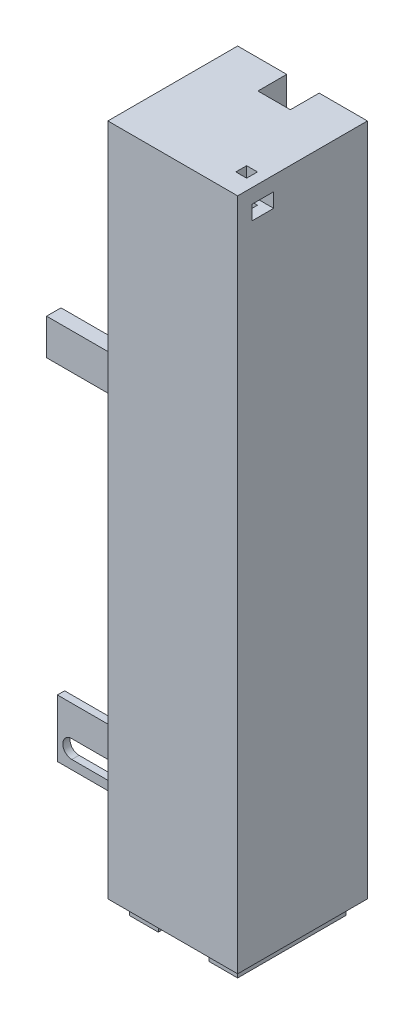
from build123d import *

# Parameters (mm, degrees)
SKETCH1_W           = 36
SKETCH1_H           = 36
BOSS_EXTRUDE1_DEPTH = 186.9
BOSS_EXTRUDE2_DEPTH = 4
SKETCH3_R           = 2
CUT_EXTRUDE1_DEPTH  = 5
SKETCH4_W           = 9
SKETCH4_H           = 186.9
CUT_EXTRUDE2_DEPTH  = 8
SKETCH5_W           = 6
SKETCH5_H           = 4
CUT_EXTRUDE3_DEPTH  = 9
SKETCH6_W           = 3
SKETCH6_H           = 3
CUT_EXTRUDE4_DEPTH  = 10
SKETCH7_W           = 2
SKETCH7_H           = 16
BOSS_EXTRUDE3_DEPTH = 40
CUT_EXTRUDE5_REACH  = 194.893
SKETCH9_W           = 4
SKETCH9_H           = 10
BOSS_EXTRUDE4_DEPTH = 45
CHAMFER1_SIZE       = 20
CUT_EXTRUDE6_DEPTH  = 27


with BuildPart() as part:
    # Sketch1 → Boss-Extrude1 (new body)
    with BuildSketch(Plane(origin=(0, 0, 0), x_dir=(1, 0, 0), z_dir=(0, 1, 0))):
        with Locations((18, 18)):
            Rectangle(SKETCH1_W, SKETCH1_H)
    extrude(amount=BOSS_EXTRUDE1_DEPTH)

    # Sketch2 → Boss-Extrude2 (add)
    with BuildSketch(Plane.XZ):
        Polygon((3, -3), (7, -3), (11, -3), (11, -11), (7, -11), (7, -25), (11, -25), (11, -33), (7, -33), (3, -33), align=None)
        Polygon((29, -3), (33, -3), (33, -33), (29, -33), (25, -33), (25, -25), (29, -25), (29, -11), (25, -11), (25, -3), align=None)
    extrude(amount=BOSS_EXTRUDE2_DEPTH)

    # Sketch3 → Cut-Extrude1 (cut)
    with BuildSketch(Plane.XZ):
        with Locations((18, -18)):
            Circle(SKETCH3_R)
    extrude(amount=-CUT_EXTRUDE1_DEPTH, mode=Mode.SUBTRACT)

    # Sketch4 → Cut-Extrude2 (cut)
    with BuildSketch(Plane.XY.offset(-36)):
        with Locations((18.12, 93.45)):
            Rectangle(SKETCH4_W, SKETCH4_H)
    extrude(amount=CUT_EXTRUDE2_DEPTH, mode=Mode.SUBTRACT)

    # Sketch5 → Cut-Extrude3 (cut)
    with BuildSketch(Plane(origin=(36, 0, 0), x_dir=(0, 0, -1), z_dir=(1, 0, 0))):
        with Locations((7, 180.9)):
            Rectangle(SKETCH5_W, SKETCH5_H)
    extrude(amount=-CUT_EXTRUDE3_DEPTH, mode=Mode.SUBTRACT)

    # Sketch6 → Cut-Extrude4 (cut)
    with BuildSketch(Plane(origin=(0, 186.9, 0), x_dir=(1, 0, 0), z_dir=(0, 1, 0))):
        with Locations((31.5, 7)):
            Rectangle(SKETCH6_W, SKETCH6_H)
    extrude(amount=-CUT_EXTRUDE4_DEPTH, mode=Mode.SUBTRACT)

    # Sketch7 → Boss-Extrude3 (add)
    with BuildSketch(Plane.ZY):
        with Locations((-27, 8)):
            Rectangle(SKETCH7_W, SKETCH7_H)
    extrude(amount=BOSS_EXTRUDE3_DEPTH)

    # Sketch8 → Cut-Extrude5 (cut, up to next)
    with BuildSketch(Plane.XY.offset(-26), mode=Mode.PRIVATE) as cut_extrude5_sk1:
        with BuildLine():
            Line((-36, 7.5), (-12, 7.5))
            ThreePointArc((-12, 7.5), (-9.5, 5), (-12, 2.5))
            Line((-12, 2.5), (-36, 2.5))
            ThreePointArc((-36, 2.5), (-38.5, 5), (-36, 7.5))
        make_face()
    cut_extrude5_tool1 = extrude(cut_extrude5_sk1.sketch, amount=-CUT_EXTRUDE5_REACH, mode=Mode.PRIVATE) & part.part
    add(cut_extrude5_tool1.solids().sort_by_distance((-24, 5, -26))[0], mode=Mode.SUBTRACT)

    # Sketch9 → Boss-Extrude4 (add)
    with BuildSketch(Plane.ZY):
        with Locations((-30, 98.5)):
            Rectangle(SKETCH9_W, SKETCH9_H)
    extrude(amount=BOSS_EXTRUDE4_DEPTH)

    # Chamfer1
    chamfer1_edges = [part.edges().sort_by_distance(p)[0] for p in [
        (0, 93.5, -30),
        (0, 16, -27),
    ]]
    chamfer(chamfer1_edges, length=CHAMFER1_SIZE)

    # Sketch10 → Cut-Extrude6 (cut)
    with BuildSketch(Plane.XY.offset(-26)):
        Polygon((-17.171572875, 93.5), (-2, 78.328427125), (-2, 93.5), align=None)
        Polygon((-17.171572875, 16), (-2, 31.171572875), (-2, 16), align=None)
    extrude(amount=-CUT_EXTRUDE6_DEPTH, mode=Mode.SUBTRACT)


solid = part.part
